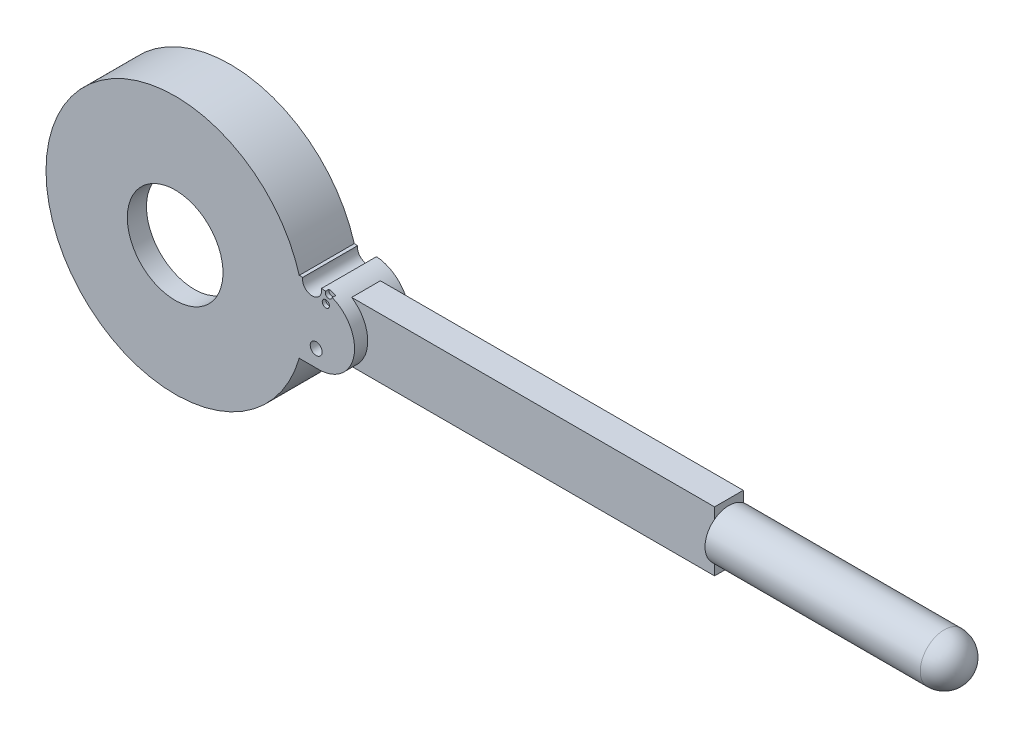
from build123d import *

# Parameters (mm, degrees)
BOSS_EXTRUDE1_DEPTH           = 23
CUT_EXTRUDE1_DEPTH            = 15
BOSS_EXTRUDE2_REACH           = 282.216
BOSS_EXTRUDE2_END_RADIUS      = 15
SKETCH3_W                     = 12
SKETCH3_H                     = 25
CUT_EXTRUDE2_DEPTH            = 0.5
BOSS_EXTRUDE3_DEPTH           = 0.5
CUT_EXTRUDE3_DEPTH            = 0.5
BOSS_EXTRUDE4_DEPTH           = 0.5
CUT_EXTRUDE4_DEPTH            = 0.5
BOSS_EXTRUDE5_DEPTH           = 0.5
CUT_EXTRUDE5_DEPTH            = 0.5
BOSS_EXTRUDE6_DEPTH           = 0.5
CUT_EXTRUDE6_DEPTH            = 0.5
BOSS_EXTRUDE7_DEPTH           = 0.5
CUT_EXTRUDE7_DEPTH            = 0.5
CUT_EXTRUDE8_DEPTH            = 0.5
SKETCH16_W                    = 4.90625
SKETCH16_H                    = 2.2734375
CUT_EXTRUDE9_DEPTH            = 0.5
SKETCH17_W                    = 3.0078125
SKETCH17_H                    = 11.6640625
CUT_EXTRUDE10_DEPTH           = 0.5
SKETCH18_W                    = 100
SKETCH18_H                    = 10
F_8_0_8_DIAMETER_HOLE1_D      = 8
F_5_0_5_DIAMETER_HOLE1_D      = 5
TAP_DRILL_FOR_M39_HELICOIL1_D = 40
F_3_0_3_DIAMETER_HOLE1_D      = 3
F_3_0_3_DIAMETER_HOLE1_DEPTH  = 1.5
FILLET1_R                     = 1.412284342
FILLET2_R                     = 2.07905533
FILLET3_R                     = 3.070846318
FILLET4_R                     = 3.22526269
FILLET5_R                     = 3.441550783
FILLET6_START                 = 5.5
FILLET6_DEPTH                 = 1.5
FILLET7_R                     = 9.990039186
FILLET8_START                 = 5.5
FILLET8_DEPTH                 = 1.5


with BuildPart() as part:
    # Sketch1 → Boss-Extrude1 (new body)
    with BuildSketch(Plane(origin=(0, 0, 0), x_dir=(-1, 0, 0), z_dir=(0, 0, -1))):
        with BuildLine():
            Line((-60, -15), (-51.874849397, -15))
            ThreePointArc((-51.874849397, -15), (54, 0), (-51.874849397, 15))
            Line((-51.874849397, 15), (-60, 15))
            ThreePointArc((-60, 15), (-75, 0), (-60, -15))
        make_face()
    extrude(amount=-BOSS_EXTRUDE1_DEPTH)

    # Sketch2 → Cut-Extrude1 (cut)
    with BuildSketch(Plane(origin=(0, 0, 0), x_dir=(-1, 0, 0), z_dir=(0, 0, -1))):
        with BuildLine():
            Line((-60, -15), (-54.929646445, -15))
            Line((-54.929646445, -15), (-44.637919846, -11.111080587))
            ThreePointArc((-44.637919846, -11.111080587), (45.9148086, 2.798276473), (-45.656867784, 5.608067777))
            Line((-45.656867784, 5.608067777), (-67.403963318, -2.609474848))
            Line((-67.403963318, -2.609474848), (-62.823277674, -14.731907656))
            ThreePointArc((-62.823277674, -14.731907656), (-61.417988922, -14.932826505), (-60, -15))
        make_face()
    extrude(amount=-CUT_EXTRUDE1_DEPTH, mode=Mode.SUBTRACT)

    # Boss-Extrude2: up to this cylinder (the profile starts outside it)
    boss_extrude2_end = Plane(origin=(60, 0, 11.5), z_dir=(0, 0, -1)) * Cylinder(BOSS_EXTRUDE2_END_RADIUS, 595.432, mode=Mode.PRIVATE)
    # Sketch3 → Boss-Extrude2 (add, up to the surface)
    with BuildSketch(Plane(origin=(220, 0, 0), x_dir=(0, 0, -1), z_dir=(1, 0, 0)), mode=Mode.PRIVATE) as boss_extrude2_sk1:
        with Locations((-11.5, 0)):
            Rectangle(SKETCH3_W, SKETCH3_H)
    boss_extrude2_tool1 = extrude(boss_extrude2_sk1.sketch, amount=-BOSS_EXTRUDE2_REACH, mode=Mode.PRIVATE) - boss_extrude2_end
    add(boss_extrude2_tool1.solids().sort_by_distance((220, 0, 11.5))[0])

    # Sketch4 → Cut-Extrude2 (cut)
    with BuildSketch(Plane(origin=(0, 0, 5.5), x_dir=(-1, 0, 0), z_dir=(0, 0, -1))):
        with BuildLine():
            Line((-164.0703125, -6.125), (-164.0703125, 5.5390625))
            Line((-164.0703125, 5.5390625), (-169.8671875, 5.5390625))
            add(Edge.make_bspline(
                [(-173.4296875, 3.875), (-172.4921875, 4.78125), (-171.1796875, 5.16015625), (-169.8671875, 5.5390625)],
                knots=[0, 0, 0, 0, 1, 1, 1, 1], degree=3))
            ThreePointArc((-173.4296875, 3.875), (-174.140331686, 3.030547983), (-174.6484375, 2.05078125))
            ThreePointArc((-174.6484375, 2.05078125), (-174.956946445, 0.891533774), (-175.046875, -0.3046875))
            ThreePointArc((-175.046875, -0.3046875), (-174.955491082, -1.491049482), (-174.6484375, -2.640625))
            ThreePointArc((-174.6484375, -2.640625), (-174.139959679, -3.618334726), (-173.4296875, -4.4609375))
            add(Edge.make_bspline(
                [(-169.8984375, -6.125), (-171.19921875, -5.74609375), (-172.5, -5.3671875), (-173.4296875, -4.4609375)],
                knots=[0, 0, 0, 0, 1, 1, 1, 1], degree=3))
            Line((-169.8984375, -6.125), (-164.0703125, -6.125))
        make_face()
    extrude(amount=-CUT_EXTRUDE2_DEPTH, mode=Mode.SUBTRACT)

    # Sketch5 → Boss-Extrude3 (add)
    with BuildSketch(Plane(origin=(0, 0, 6), x_dir=(-1, 0, 0), z_dir=(0, 0, -1))):
        with BuildLine():
            Line((-167.078125, -3.8515625), (-168.15625, -3.8515625))
            add(Edge.make_bspline(
                [(-171.9453125, -2.0390625), (-170.9765625, -2.9453125), (-170.0078125, -3.8515625), (-168.15625, -3.8515625)],
                knots=[0, 0, 0, 0, 1, 1, 1, 1], degree=3))
            add(Edge.make_bspline(
                [(-170.97265625, 2.3515625), (-171.943858604, 1.438866312), (-171.9453125, -0.299479167), (-171.9453125, -2.0390625)],
                knots=[0, 0, 0, 0, 1, 1, 1, 1], degree=3))
            add(Edge.make_bspline(
                [(-168.15625, 3.265625), (-169.385416667, 3.265625), (-170.32421875, 2.9609375), (-170.97265625, 2.3515625)],
                knots=[0, 0, 0, 0, 1, 1, 1, 1], degree=3))
            Line((-168.15625, 3.265625), (-167.078125, 3.265625))
            Line((-167.078125, 3.265625), (-167.078125, -3.8515625))
        make_face()
    extrude(amount=BOSS_EXTRUDE3_DEPTH)

    # Sketch6 → Cut-Extrude3 (cut)
    with BuildSketch(Plane(origin=(0, 0, 5.5), x_dir=(-1, 0, 0), z_dir=(0, 0, -1))):
        with BuildLine():
            Line((-192.7421875, 1.125), (-193.59375, 1.125))
            add(Edge.make_bspline(
                [(-195.211624157, 1.766123282), (-194.769989022, 1.445644688), (-194.328505801, 1.125), (-193.59375, 1.125)],
                knots=[0, 0, 0, 0, 1, 1, 1, 1], degree=3))
            Line((-195.211624157, 1.766123282), (-197.0625, 5.5390625))
            Line((-197.0625, 5.5390625), (-200.265625, 5.5390625))
            Line((-200.265625, 5.5390625), (-198.139271979, 1.225312831))
            add(Edge.make_bspline(
                [(-196.5390625, 0.0859375), (-197.158971594, 0.22718261), (-197.648837569, 0.72703147), (-198.139271979, 1.225312831)],
                knots=[0, 0, 0, 0, 1, 1, 1, 1], degree=3))
            add(Edge.make_bspline(
                [(-198.78125, -1.75), (-198.22265625, -1.0078125), (-197.6640625, -0.265625), (-196.5390625, 0.0859375)],
                knots=[0, 0, 0, 0, 1, 1, 1, 1], degree=3))
            add(Edge.make_bspline(
                [(-197.70703125, -5.3515625), (-198.670816297, -4.657637266), (-198.78125, -3.25), (-198.78125, -1.75)],
                knots=[0, 0, 0, 0, 1, 1, 1, 1], degree=3))
            add(Edge.make_bspline(
                [(-194.328125, -6.125), (-195.864583333, -6.125), (-196.990885417, -5.8671875), (-197.70703125, -5.3515625)],
                knots=[0, 0, 0, 0, 1, 1, 1, 1], degree=3))
            Line((-194.328125, -6.125), (-189.734375, -6.125))
            Line((-189.734375, -6.125), (-189.734375, 5.5390625))
            Line((-189.734375, 5.5390625), (-192.7421875, 5.5390625))
            Line((-192.7421875, 5.5390625), (-192.7421875, 1.125))
        make_face()
    extrude(amount=-CUT_EXTRUDE3_DEPTH, mode=Mode.SUBTRACT)

    # Sketch7 → Boss-Extrude4 (add)
    with BuildSketch(Plane(origin=(0, 0, 6), x_dir=(-1, 0, 0), z_dir=(0, 0, -1))):
        with BuildLine():
            Line((-192.7421875, -0.953125), (-192.7421875, -3.9453125))
            Line((-192.7421875, -3.9453125), (-194.0078125, -3.9453125))
            add(Edge.make_bspline(
                [(-195.7734375, -3.2578125), (-195.36328125, -3.6015625), (-194.953125, -3.9453125), (-194.0078125, -3.9453125)],
                knots=[0, 0, 0, 0, 1, 1, 1, 1], degree=3))
            add(Edge.make_bspline(
                [(-194.953125, -0.953125), (-195.498672634, -1.420737257), (-195.7734375, -2.1875), (-195.7734375, -3.2578125)],
                knots=[0, 0, 0, 0, 1, 1, 1, 1], degree=3))
            Line((-194.953125, -0.953125), (-192.7421875, -0.953125))
        make_face()
    extrude(amount=BOSS_EXTRUDE4_DEPTH)

    # Sketch8 → Cut-Extrude4 (cut)
    with BuildSketch(Plane(origin=(0, 0, 5.5), x_dir=(-1, 0, 0), z_dir=(0, 0, -1))):
        Polygon((-184.4296875, 3.4140625), (-185.1640625, 5.5390625), (-188.1875, 5.5390625), (-183.8671875, -6.125), (-180.28125, -6.125), (-175.9609375, 5.5390625), (-178.984375, 5.5390625), (-179.7265625, 3.4140625), align=None)
    extrude(amount=-CUT_EXTRUDE4_DEPTH, mode=Mode.SUBTRACT)

    # Sketch9 → Boss-Extrude5 (add)
    with BuildSketch(Plane(origin=(0, 0, 6), x_dir=(-1, 0, 0), z_dir=(0, 0, -1))):
        Polygon((-180.4765625, 1.25), (-182.078125, -3.390625), (-183.671875, 1.25), align=None)
    extrude(amount=BOSS_EXTRUDE5_DEPTH)

    # Sketch10 → Cut-Extrude5 (cut)
    with BuildSketch(Plane(origin=(0, 0, 5.5), x_dir=(-1, 0, 0), z_dir=(0, 0, -1))):
        Polygon((-158.765625, 3.4140625), (-159.5, 5.5390625), (-162.5234375, 5.5390625), (-158.203125, -6.125), (-154.6171875, -6.125), (-150.296875, 5.5390625), (-153.3203125, 5.5390625), (-154.0625, 3.4140625), align=None)
    extrude(amount=-CUT_EXTRUDE5_DEPTH, mode=Mode.SUBTRACT)

    # Sketch11 → Boss-Extrude6 (add)
    with BuildSketch(Plane(origin=(0, 0, 6), x_dir=(-1, 0, 0), z_dir=(0, 0, -1))):
        Polygon((-154.8125, 1.25), (-156.4140625, -3.390625), (-158.0078125, 1.25), align=None)
    extrude(amount=BOSS_EXTRUDE6_DEPTH)

    # Sketch12 → Cut-Extrude6 (cut)
    with BuildSketch(Plane(origin=(0, 0, 5.5), x_dir=(-1, 0, 0), z_dir=(0, 0, -1))):
        Polygon((-97.9609375, 3.4140625), (-98.6953125, 5.5390625), (-101.71875, 5.5390625), (-97.3984375, -6.125), (-93.8125, -6.125), (-89.4921875, 5.5390625), (-92.515625, 5.5390625), (-93.2578125, 3.4140625), align=None)
    extrude(amount=-CUT_EXTRUDE6_DEPTH, mode=Mode.SUBTRACT)

    # Sketch13 → Boss-Extrude7 (add)
    with BuildSketch(Plane(origin=(0, 0, 6), x_dir=(-1, 0, 0), z_dir=(0, 0, -1))):
        Polygon((-94.0078125, 1.25), (-95.609375, -3.390625), (-97.203125, 1.25), align=None)
    extrude(amount=BOSS_EXTRUDE7_DEPTH)

    # Sketch14 → Cut-Extrude7 (cut)
    with BuildSketch(Plane(origin=(0, 0, 5.5), x_dir=(-1, 0, 0), z_dir=(0, 0, -1))):
        Polygon((-138.296875, -6.125), (-138.296875, 5.5390625), (-141.3046875, 5.5390625), (-141.3046875, 0.59375), (-145.7421875, 0.59375), (-145.7421875, 5.5390625), (-148.75, 5.5390625), (-148.75, -6.125), (-145.7421875, -6.125), (-145.7421875, -1.6796875), (-141.3046875, -1.6796875), (-141.3046875, -6.125), align=None)
    extrude(amount=-CUT_EXTRUDE7_DEPTH, mode=Mode.SUBTRACT)

    # Sketch15 → Cut-Extrude8 (cut)
    with BuildSketch(Plane(origin=(0, 0, 5.5), x_dir=(-1, 0, 0), z_dir=(0, 0, -1))):
        Polygon((-100.7890625, -6.125), (-105.109375, 5.5390625), (-108.6953125, 5.5390625), (-113.015625, -6.125), (-109.9921875, -6.125), (-106.90625, 2.484375), (-103.8125, -6.125), align=None)
    extrude(amount=-CUT_EXTRUDE8_DEPTH, mode=Mode.SUBTRACT)

    # Sketch16 → Cut-Extrude9 (cut)
    with BuildSketch(Plane(origin=(0, 0, 5.5), x_dir=(-1, 0, 0), z_dir=(0, 0, -1))):
        with Locations((-127.9375, 0.93359375)):
            Rectangle(SKETCH16_W, SKETCH16_H)
    extrude(amount=-CUT_EXTRUDE9_DEPTH, mode=Mode.SUBTRACT)

    # Sketch17 → Cut-Extrude10 (cut)
    with BuildSketch(Plane(origin=(0, 0, 5.5), x_dir=(-1, 0, 0), z_dir=(0, 0, -1))):
        with Locations((-116.06640625, -0.29296875)):
            Rectangle(SKETCH17_W, SKETCH17_H)
    extrude(amount=-CUT_EXTRUDE10_DEPTH, mode=Mode.SUBTRACT)

    # Sketch18 → Revolve1 (revolve)
    with BuildSketch(Plane(origin=(0, 0, 11.5), x_dir=(-1, 0, 0), z_dir=(0, 0, -1)), mode=Mode.PRIVATE) as revolve1_sk:
        with Locations((-270, 5)):
            Rectangle(SKETCH18_W, SKETCH18_H)
    revolve(revolve1_sk.sketch.rotate(Axis((320, 0, 11.5), (-1, 0, 0)), 270), axis=Axis((320, 0, 11.5), (-1, 0, 0)))

    # Ø8.0 (8) Diameter Hole1 (through all)
    with Locations(Plane.XY.offset(23)):
        with Locations((57.24744785, 14.27339184)):
            Hole(F_8_0_8_DIAMETER_HOLE1_D / 2)

    # Ø5.0 (5) Diameter Hole1 (through all)
    with Locations(Plane(origin=(0, 0, 15), x_dir=(-1, 0, 0), z_dir=(0, 0, -1))):
        with Locations((-58.963500383, -7.972178032)):
            Hole(F_5_0_5_DIAMETER_HOLE1_D / 2)

    # Tap Drill for M39 Helicoil1 (through all)
    with Locations(Plane(origin=(0, 0, 15), x_dir=(-1, 0, 0), z_dir=(0, 0, -1))):
        with Locations((0, 0)):
            Hole(TAP_DRILL_FOR_M39_HELICOIL1_D / 2)

    # Ø3.0 (3) Diameter Hole1
    with Locations(Plane.XY.offset(23)):
        with Locations((62.98151216, 10.258356786), (64.24744785, 14.27339184)):
            Hole(F_3_0_3_DIAMETER_HOLE1_D / 2, depth=F_3_0_3_DIAMETER_HOLE1_DEPTH)

    # Fillet1
    fillet1_edges = [part.edges().sort_by_distance(p)[0] for p in [
        (195.7734375, -3.2578125, 5.75),
    ]]
    fillet(fillet1_edges, radius=FILLET1_R)

    # Fillet2
    # the kernel refuses this fillet: 2.07905533 mm, written as the material it takes off along each edge
    with BuildSketch(Plane(origin=(194.953125, -0.953125, 6), x_dir=(0.4983238238531012, -0.8669909841402178, 0), z_dir=(0, 0, -1))) as fillet2_piece_1:
        with BuildLine():
            CenterArc((1.208738801, 2.06911578), FILLET2_R, 209.8891669, 65.715646275)
            Line((-0.593783426, 1.033072978), (-0.62983387, 1.012352122))
            Line((-0.62983387, 1.012352122), (-0.036050445, -0.020720856))
            Line((-0.036050445, -0.020720856), (-0.013886584, -0.039193765))
            ThreePointArc((-0.013886584, -0.039193765), (0.708491184, -0.153595229), (1.415853949, -0.041382316))
            Line((1.415853949, -0.041382316), (1.411792867, 0))
        make_face()
    extrude(amount=4.029482168, mode=Mode.SUBTRACT)

    # Fillet3
    fillet3_edges = [part.edges().sort_by_distance(p)[0] for p in [
        (198.78125, -1.75, 5.75),
    ]]
    fillet(fillet3_edges, radius=FILLET3_R)

    # Fillet4
    # the kernel refuses this fillet: 3.22526269 mm, written as the material it takes off along each edge
    with BuildSketch(Plane(origin=(195.211624157, 1.766123282, -0.52885706), x_dir=(0.44042499365627896, 0.8977894101418588, 0), z_dir=(0, 0, 1))) as fillet4_piece_1:
        with BuildLine():
            CenterArc((1.29613147, 3.22526269), FILLET4_R, 206.131000545, 63.868999455)
            Line((-1.599475218, 1.80477639), (-1.889035887, 1.66272776))
            ThreePointArc((-1.889035887, 1.66272776), (-1.577706578, 1.028094938), (-0.150929453, -0.285032444))
            Line((-0.150929453, -0.285032444), (0, -0.322526269))
            Line((0, -0.322526269), (1.29613147, -0.322526269))
            Line((1.29613147, -0.322526269), (1.29613147, 0))
        make_face()
    extrude(amount=6.52885706, mode=Mode.SUBTRACT)

    # Fillet5
    # the kernel refuses this fillet: 3.441550783 mm, written as the material it takes off along each edge
    with BuildSketch(Plane(origin=(171.9453125, -2.0390625, 6), x_dir=(-0.028598923241017205, 0.9995909671407873, 0), z_dir=(0, 0, -1))) as fillet5_piece_1:
        with BuildLine():
            CenterArc((1.756179381, -3.435147573), FILLET5_R, 86.504359351, 82.499227166)
            Line((-1.62218152, -2.778680198), (-1.689748738, -2.76555085))
            ThreePointArc((-1.689748738, -2.76555085), (-1.0632901, -1.228131616), (-0.051589553, 0.045565631))
            Line((-0.051589553, 0.045565631), (-0.001968493, 0.068802862))
            ThreePointArc((-0.001968493, 0.068802862), (0.982292689, 0.090203195), (1.970216473, 0.068702951))
            Line((1.970216473, 0.068702951), (1.966019668, 0))
        make_face()
    extrude(amount=0.5, mode=Mode.SUBTRACT)

    # Fillet6: read off the stored shape, not the designer's step
    # Fillet6 outline → Fillet6 (add)
    with BuildSketch(Plane.XY.offset(FILLET6_START)):
        with BuildLine():
            Line((198.139271979, 1.225312831), (198.783763773, 2.532798575))
            ThreePointArc((198.783763773, 2.532798575), (197.836544352, 1.148706173), (196.5390625, 0.0859375))
            add(Edge.make_bspline(
                [(198.139271979, 1.225312831), (197.648837569, 0.72703147), (197.158971594, 0.22718261), (196.5390625, 0.0859375)],
                knots=[0, 0, 0, 0, 1, 1, 1, 1], degree=3))
        make_face()
    extrude(amount=FILLET6_DEPTH)

    # Fillet7
    fillet7_edges = [part.edges().sort_by_distance(p)[0] for p in [
        (320, 0, 1.5),
    ]]
    fillet(fillet7_edges, radius=FILLET7_R)

    # Fillet8: read off the stored shape, not the designer's step
    # Fillet8 outline → Fillet8 (add)
    with BuildSketch(Plane.XY.offset(FILLET8_START)):
        with BuildLine():
            add(Edge.make_bspline(
                [(173.4296875, -4.4609375), (172.5, -5.3671875), (171.19921875, -5.74609375), (169.8984375, -6.125)],
                knots=[0, 0, 0, 0, 1, 1, 1, 1], degree=3))
            ThreePointArc((173.4296875, -4.4609375), (170.068022443, -5.703138996), (166.509105501, -6.125))
            Line((166.509105501, -6.125), (169.8984375, -6.125))
        make_face()
        with BuildLine():
            Line((169.8671875, 5.5390625), (166.509105501, 5.5390625))
            ThreePointArc((166.509105501, 5.5390625), (170.068022443, 5.117201496), (173.4296875, 3.875))
            add(Edge.make_bspline(
                [(169.8671875, 5.5390625), (171.1796875, 5.16015625), (172.4921875, 4.78125), (173.4296875, 3.875)],
                knots=[0, 0, 0, 0, 1, 1, 1, 1], degree=3))
        make_face()
    extrude(amount=FILLET8_DEPTH)


solid = part.part
